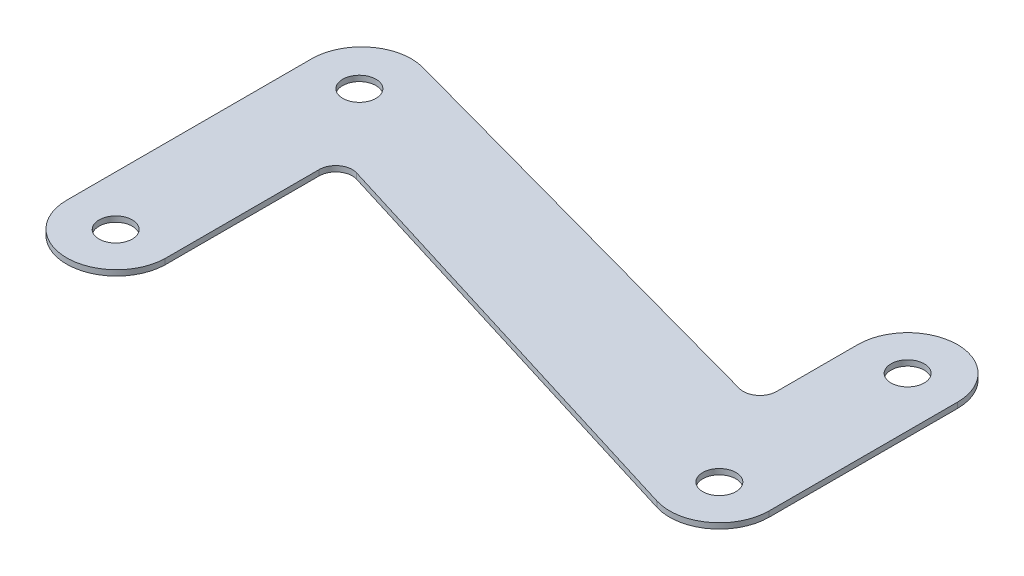
from build123d import *

# Parameters (mm, degrees)
SKETCH1_R           = 3
BOSS_EXTRUDE2_DEPTH = 1


with BuildPart() as part:
    # Sketch1 → Boss-Extrude2 (new body)
    with BuildSketch(Plane(origin=(0, 0, 0), x_dir=(1, 0, 0), z_dir=(0, 1, 0))):
        with BuildLine():
            Line((-56, -43.863685539), (-56, 0.391814312))
            ThreePointArc((-56, 0.391814312), (-52.457062288, 7.548662164), (-44.617673071, 9.070784204))
            Line((-44.617673071, 9.070784204), (34.205891024, -12.565827248))
            ThreePointArc((34.205891024, -12.565827248), (36.819020763, -12.058453234), (38, -9.672837283))
            Line((38, -9.672837283), (38, 5))
            ThreePointArc((38, 5), (47, 14), (56, 5))
            Line((56, 5), (56, -29))
            ThreePointArc((56, -29), (52.344211441, -36.24150565), (44.346799095, -37.600030521))
            Line((44.346799095, -37.600030521), (-34.115599698, -13.393545787))
            ThreePointArc((-34.115599698, -13.393545787), (-36.781403814, -13.84638741), (-38, -16.260222627))
            Line((-38, -16.260222627), (-38, -44.136314461))
            ThreePointArc((-38, -44.136314461), (-47.13426547, -52.864717793), (-56, -43.863685539))
        make_face()
        with Locations(Location((-47, 0, 0), (0, 0, 270))):
            Circle(SKETCH1_R, mode=Mode.SUBTRACT)
        with Locations(Location((47, -29, 0), (0, 0, 270))):
            Circle(SKETCH1_R, mode=Mode.SUBTRACT)
        with Locations(Location((-47, -44, 0), (0, 0, 270))):
            Circle(SKETCH1_R, mode=Mode.SUBTRACT)
        with Locations(Location((47, 5, 0), (0, 0, 270))):
            Circle(SKETCH1_R, mode=Mode.SUBTRACT)
    extrude(amount=BOSS_EXTRUDE2_DEPTH)


solid = part.part
